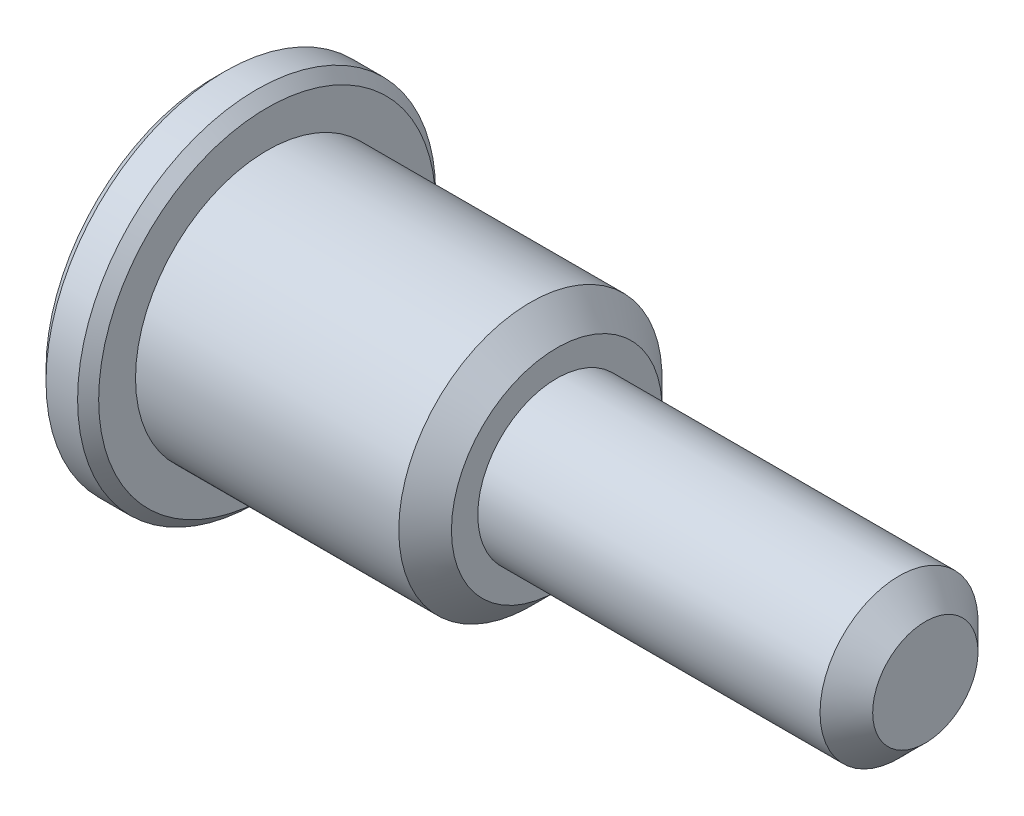
from build123d import *

# Parameters (mm, degrees)
CHAMFER_1_SIZE = 0.5
CHAMFER_2_SIZE = 0.2


with BuildPart() as part:
    # 草图1 → 旋转1 (revolve)
    with BuildSketch(Plane.XY):
        Polygon((0, 0), (0, 3.4), (1, 3.4), (1, 2.5), (6.5, 2.5), (6.5, 1.5), (13.5, 1.5), (13.5, 0), align=None)
    revolve(axis=Axis((0, 0, 0), (1, 0, 0)))

    # 倒角1
    chamfer_1_edges = [part.edges().sort_by_distance(p)[0] for p in [
        (6.5, -2.5, 0),
        (13.5, -1.5, 0),
    ]]
    chamfer(chamfer_1_edges, length=CHAMFER_1_SIZE)

    # 倒角2
    chamfer_2_edges = [part.edges().sort_by_distance(p)[0] for p in [
        (1, -3.4, 0),
        (0, -3.4, 0),
    ]]
    chamfer(chamfer_2_edges, length=CHAMFER_2_SIZE)


solid = part.part
